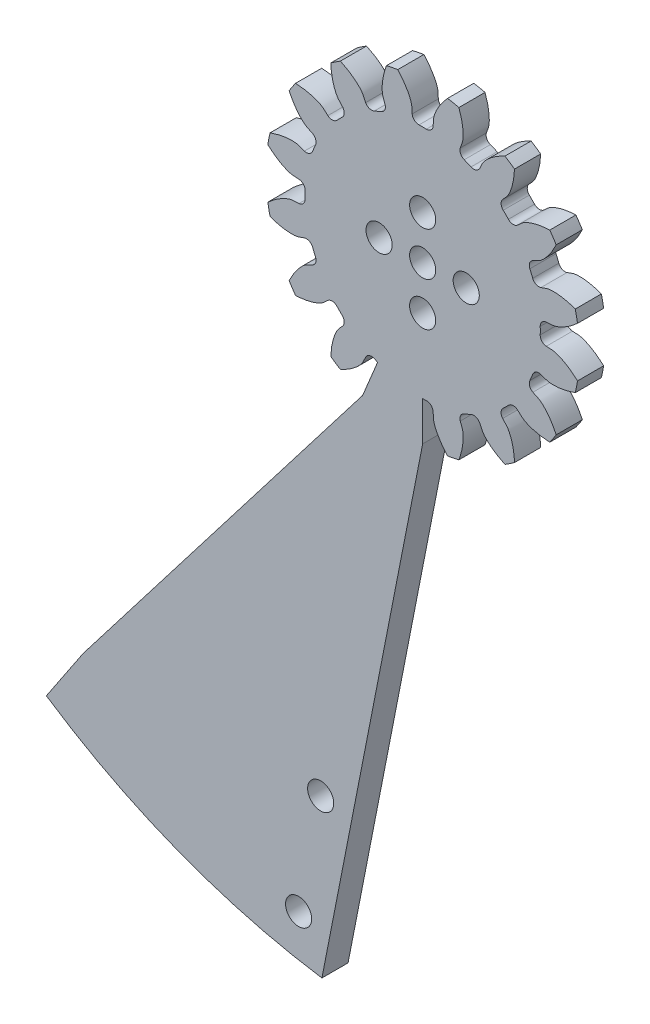
from build123d import *

# Parameters (mm, degrees)
SKETCH_1_R          = 18
LASHENA_DEPTH       = 3
CUT_EXTRUDEA_DEPTH  = 3
WWW_KYTOOL_CN_COUNT = 16
SKETCH_3_R          = 1.5
CUT_EXTRUDE_2_DEPTH = 10
SKETCH_4_R          = 1.5
CUT_EXTRUDE_3_DEPTH = 10
EXTRUDE_1_DEPTH     = 3
SKETCH_6_R          = 1.5
CUT_EXTRUDE_4_DEPTH = 3
EXTRUDE_2_DEPTH     = 3


with BuildPart() as part:
    # 草图1 → LaShenA (new body)
    with BuildSketch(Plane.XY):
        Circle(SKETCH_1_R)
    extrude(amount=LASHENA_DEPTH)

    # SketchA → Cut-ExtrudeA (cut)
    with BuildSketch(Plane.XY.offset(3)):
        with BuildLine():
            ThreePointArc((0.423212707, 13.493364703), (0, 13.5), (-0.423212707, 13.493364703))
            ThreePointArc((-0.423212707, 13.493364703), (-0.952770902, 13.685686791), (-1.20440395, 14.18977059))
            add(Edge.make_bspline(
                [(-1.20440395, 14.18977059), (-1.226562505, 14.455224305), (-1.213843633, 14.773889884), (-1.273675597, 15.110607864), (-1.299119688, 15.21139578), (-1.321432077, 15.29109757), (-1.349914152, 15.382250837), (-1.385146673, 15.484587535), (-1.427834192, 15.597770763), (-1.478623281, 15.721446817), (-1.538159915, 15.855229004), (-1.607069773, 15.998703507), (-1.685962928, 16.151428337), (-1.775430978, 16.312934487), (-1.876046532, 16.482726463), (-1.98836201, 16.660283053), (-2.112908684, 16.845058076), (-2.250195688, 17.036481179), (-2.400709063, 17.233958676), (-2.56491084, 17.43687441), (-2.743238138, 17.644590662), (-2.936102365, 17.856449073), (-3.14388814, 18.07177164), (-3.447378451, 18.368492697), (-3.689495989, 18.585006365), (-3.858042439, 18.727457792)],
                knots=[0.122308221, 0.122308221, 0.122308221, 0.122308221, 0.250610689, 0.276296194, 0.287604067, 0.300967916, 0.316387742, 0.333863545, 0.353395324, 0.37498308, 0.398626813, 0.424326522, 0.452082207, 0.48189387, 0.513761509, 0.547685125, 0.583664717, 0.621700286, 0.661791832, 0.703939355, 0.748142854, 0.79440233, 0.842717782, 0.893089212, 1, 1, 1, 1], degree=3))
            ThreePointArc((-3.858042439, 18.727457792), (0, 19.120726106), (3.858042439, 18.727457792))
            add(Edge.make_bspline(
                [(1.20440395, 14.18977059), (1.226562505, 14.455224305), (1.213843633, 14.773889884), (1.273675597, 15.110607864), (1.299119688, 15.21139578), (1.321432077, 15.29109757), (1.349914152, 15.382250837), (1.385146673, 15.484587535), (1.427834192, 15.597770763), (1.478623281, 15.721446817), (1.538159915, 15.855229004), (1.607069773, 15.998703507), (1.685962928, 16.151428337), (1.775430978, 16.312934487), (1.876046532, 16.482726463), (1.98836201, 16.660283053), (2.112908684, 16.845058076), (2.250195688, 17.036481179), (2.400709063, 17.233958676), (2.56491084, 17.43687441), (2.743238138, 17.644590662), (2.936102365, 17.856449073), (3.14388814, 18.07177164), (3.447378451, 18.368492697), (3.689495989, 18.585006365), (3.858042439, 18.727457792)],
                knots=[0.122308221, 0.122308221, 0.122308221, 0.122308221, 0.250610689, 0.276296194, 0.287604067, 0.300967916, 0.316387742, 0.333863545, 0.353395324, 0.37498308, 0.398626813, 0.424326522, 0.452082207, 0.48189387, 0.513761509, 0.547685125, 0.583664717, 0.621700286, 0.661791832, 0.703939355, 0.748142854, 0.79440233, 0.842717782, 0.893089212, 1, 1, 1, 1], degree=3))
            ThreePointArc((1.20440395, 14.18977059), (0.952770902, 13.685686791), (0.423212707, 13.493364703))
        make_face()
    cut_extrudea = extrude(amount=-CUT_EXTRUDEA_DEPTH, mode=Mode.SUBTRACT)

    # www.KYTool.cn: Cut-ExtrudeA ×16 about axis
    www_kytool_cn_axis = Axis((0, 0, -80.9), (0, 0, 1))
    for i in range(1, WWW_KYTOOL_CN_COUNT):
        add(cut_extrudea.rotate(www_kytool_cn_axis, i * 360 / WWW_KYTOOL_CN_COUNT), mode=Mode.SUBTRACT)

    # 草图3 → 切除-拉伸2 (cut)
    with BuildSketch(Plane(origin=(0, 0, 0), x_dir=(-1, 0, 0), z_dir=(0, 0, -1))):
        Circle(SKETCH_3_R)
    extrude(amount=-CUT_EXTRUDE_2_DEPTH, mode=Mode.SUBTRACT)

    # 草图4 → 切除-拉伸3 (cut)
    with BuildSketch(Plane(origin=(0, 0, 0), x_dir=(-1, 0, 0), z_dir=(0, 0, -1))):
        with Locations((5, 0)):
            Circle(SKETCH_4_R)
        with Locations((0, -5)):
            Circle(SKETCH_4_R)
        with Locations((-5, 0)):
            Circle(SKETCH_4_R)
        with Locations((0, 5)):
            Circle(SKETCH_4_R)
    extrude(amount=-CUT_EXTRUDE_3_DEPTH, mode=Mode.SUBTRACT)

    # 草图5 → 凸台-拉伸1 (add)
    with BuildSketch(Plane.XY.offset(3)):
        with BuildLine():
            Line((-3.48199852, -8.406288052), (-6.888301783, -16.629831585))
            Line((-6.888301783, -16.629831585), (-17.226084522, -67.950540756))
            ThreePointArc((-17.226084522, -67.950540756), (-28.498456938, -64.045701878), (-38.945489094, -58.286043408))
            Line((-38.945489094, -58.286043408), (-43.190045675, -64.638471246))
            ThreePointArc((-43.190045675, -64.638471246), (-28.051735714, -72.502497432), (-11.562659331, -76.875333623))
            Line((-11.562659331, -76.875333623), (0, -18))
            Line((0, -18), (0, -9.09890062))
            ThreePointArc((0, -9.09890062), (-1.775107452, -8.924067796), (-3.48199852, -8.406288052))
        make_face()
    extrude(amount=-EXTRUDE_1_DEPTH)

    # 草图6 → 切除-拉伸4 (cut)
    with BuildSketch(Plane(origin=(0, 0, 0), x_dir=(-1, 0, 0), z_dir=(0, 0, -1))):
        with Locations((14.241593507, -71.597325469)):
            Circle(SKETCH_6_R)
        with Locations((11.705419321, -58.847116824)):
            Circle(SKETCH_6_R)
    extrude(amount=-CUT_EXTRUDE_4_DEPTH, mode=Mode.SUBTRACT)

    # 草图7 → 凸台-拉伸2 (add)
    with BuildSketch(Plane(origin=(0, 0, 0), x_dir=(-1, 0, 0), z_dir=(0, 0, -1))):
        Polygon((6.888301783, -16.629831585), (38.945489094, -58.286043408), (31.634833633, -68.811377257), (17.226084522, -67.950540756), align=None)
    extrude(amount=-EXTRUDE_2_DEPTH)


solid = part.part
